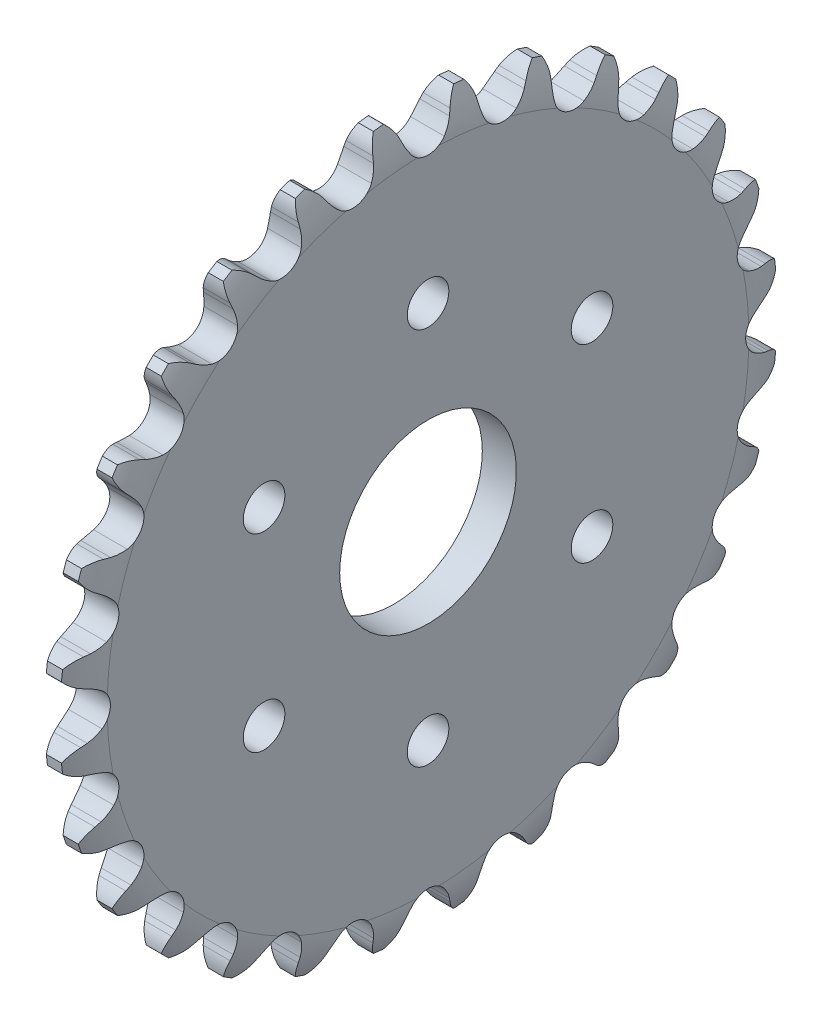
from build123d import *

# Parameters (mm, degrees)
TOOTHCUT_DEPTH    = 64.961530727
TEETHCUTS_COUNT   = 28
TEETHCUTS_ANGLE   = 347.142857143
BORSKE_R          = 11.1125
BORE_DEPTH        = 50.8000508
EXTRUDE1_DEPTH    = 64.655554764
CIRPATTERN1_COUNT = 6


with BuildPart() as part:
    # BasProSke → Base-Revolve (revolve)
    with BuildSketch(Plane(origin=(0, 0, 0), x_dir=(1, 0, 0), z_dir=(0, 1, 0))):
        with BuildLine():
            Line((0, 0), (0, 40.350656623))
            ThreePointArc((0, 40.350656623), (0.302973008, 42.811738371), (1.1938, 45.125856623))
            Line((1.1938, 45.125856623), (3.094736, 45.125856623))
            ThreePointArc((3.094736, 45.125856623), (3.985562992, 42.811738371), (4.288536, 40.350656623))
            Line((4.288536, 40.350656623), (4.288536, 0))
            Line((4.288536, 0), (0, 0))
        make_face()
    revolve(axis=Axis((-10, 0, 0), (1, 0, 0)))

    # TooCutSke → ToothCut (cut, through all)
    with BuildSketch(Plane(origin=(0, 0, 0), x_dir=(0, 0, -1), z_dir=(1, 0, 0))):
        with BuildLine():
            Line((2.967278953, 42.589323885), (3.214806112, 43.229379625))
            ThreePointArc((3.214806112, 43.229379625), (4.731971329, 45.146509844), (7.067281237, 45.870047132))
            ThreePointArc((7.067281237, 45.870047132), (0, 46.411288367), (-7.067281237, 45.870047132))
            ThreePointArc((-7.067281237, 45.870047132), (-4.731971329, 45.146509844), (-3.214806112, 43.229379625))
            Line((-3.214806112, 43.229379625), (-2.967278953, 42.589323885))
            ThreePointArc((-2.967278953, 42.589323885), (-2.572810384, 41.748860781), (-2.0652109, 40.97147642))
            ThreePointArc((-2.0652109, 40.97147642), (0, 39.945012886), (2.0652109, 40.97147642))
            ThreePointArc((2.0652109, 40.97147642), (2.572810384, 41.748860781), (2.967278953, 42.589323885))
        make_face()
    toothcut = extrude(amount=TOOTHCUT_DEPTH, mode=Mode.SUBTRACT)

    # TeethCuts: ToothCut ×28 about axis
    teethcuts_axis = Axis((-10, 0, 0), (1, 0, 0))
    for i in range(1, TEETHCUTS_COUNT):
        add(toothcut.rotate(teethcuts_axis, i * TEETHCUTS_ANGLE / (TEETHCUTS_COUNT - 1)), mode=Mode.SUBTRACT)

    # BorSke → Bore (cut, symmetric)
    with BuildSketch(Plane(origin=(0, 0, 0), x_dir=(0, 0, -1), z_dir=(1, 0, 0))):
        Circle(BORSKE_R)
    extrude(amount=BORE_DEPTH, both=True, mode=Mode.SUBTRACT)

    # Sketch1 → Extrude1 (cut, through all)
    with BuildSketch(Plane(origin=(4.288536, 0, 0), x_dir=(0, 0, -1), z_dir=(1, 0, 0))):
        with BuildLine():
            ThreePointArc((2.6162, 23.8125), (-0.071885435, 26.427712214), (-2.612249602, 23.668783413))
            ThreePointArc((-2.612249602, 23.668783413), (0, 21.1963), (2.612249602, 23.668783413))
            ThreePointArc((2.612249602, 23.668783413), (2.615212214, 23.740614565), (2.6162, 23.8125))
        make_face()
    extrude1 = extrude(amount=-EXTRUDE1_DEPTH, mode=Mode.SUBTRACT)

    # CirPattern1: Extrude1 ×6 about axis
    cirpattern1_axis = Axis((4.288536, 0, 0), (1, 0, 0))
    for i in range(1, CIRPATTERN1_COUNT):
        add(extrude1.rotate(cirpattern1_axis, i * 360 / CIRPATTERN1_COUNT), mode=Mode.SUBTRACT)


solid = part.part
